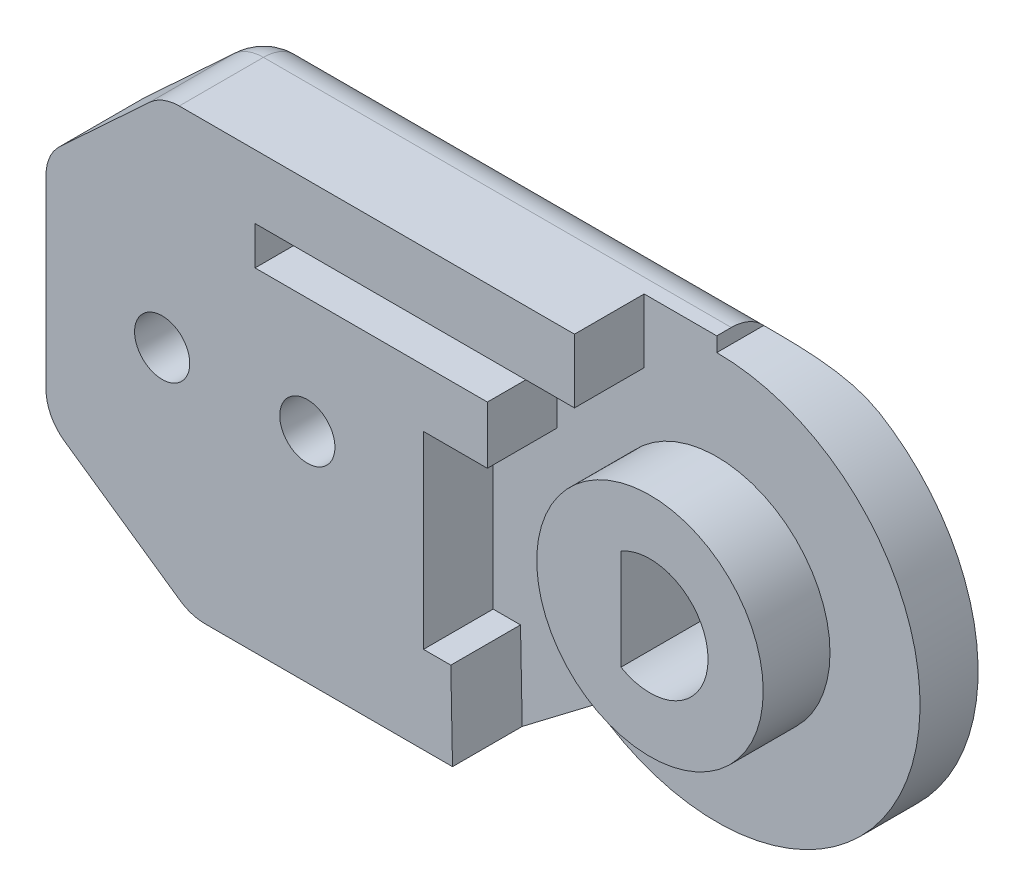
from build123d import *

# Parameters (mm, degrees)
BOSS_EXTRUDE1_DEPTH      = 2
BOSS_EXTRUDE2_DEPTH      = 6
SKETCH24_R               = 3.9
BOSS_EXTRUDE5_DEPTH      = 2.3
SKETCH30_W               = 2.408612022
SKETCH30_H               = 1.324178481
CUT_EXTRUDE12_DEPTH      = 8
CUT_EXTRUDE11_DEPTH      = 23.432788503
FILLET1_R                = 1.5
SKETCH34_R               = 0.75
CUT_EXTRUDE13_DEPTH      = 8
SKETCH35_R               = 0.75
CUT_EXTRUDE14_DEPTH      = 3
CUT_EXTRUDE14_DEPTH_BACK = 8
SKETCH36_R               = 0.95
CUT_EXTRUDE15_DEPTH      = 8
SKETCH37_R               = 2
CUT_EXTRUDE16_DEPTH      = 2.5
SKETCH38_W               = 3
SKETCH38_H               = 1.25
CUT_EXTRUDE17_DEPTH      = 3.6


with BuildPart() as part:
    # Sketch2 → Boss-Extrude1 (new body)
    with BuildSketch(Plane.XY):
        with BuildLine():
            Line((-2.5, 7.5), (-16.7, 7.5))
            Line((-16.7, 7.5), (-20.7, 3.793442666))
            Line((-20.7, 3.793442666), (-20.7, -4.031648778))
            Line((-20.7, -4.031648778), (-15.7, -7.5))
            Line((-15.7, -7.5), (-6.7, -7.5))
            Line((-6.7, -7.5), (-4.2, -5.6))
            ThreePointArc((-4.2, -5.6), (3.130495168, -6.260990337), (7, 0))
            ThreePointArc((7, 0), (4.949747468, 4.949747468), (0, 7))
            Line((0, 7), (0, 7.5))
            Line((0, 7.5), (-2.5, 7.5))
        make_face()
    extrude(amount=BOSS_EXTRUDE1_DEPTH)

    # Sketch4 → Boss-Extrude2 (add)
    with BuildSketch(Plane.XY.offset(2)):
        Polygon((-15.7, -7.5), (-6.7, -7.5), (-6.759079174, -4.5), (-7.7, -4.5), (-7.7, 2), (-5.5, 2), (-5.5, 5.3), (-2.5, 5.3), (-2.5, 7.5), (-16.7, 7.5), (-20.7, 3.793442666), (-20.7, -4.031648778), align=None)
    extrude(amount=BOSS_EXTRUDE2_DEPTH)

    # Sketch24 → Boss-Extrude5 (add)
    with BuildSketch(Plane.XY.offset(2)):
        Circle(SKETCH24_R)
    extrude(amount=BOSS_EXTRUDE5_DEPTH)

    # Sketch30 → Cut-Extrude12 (cut)
    with BuildSketch(Plane(origin=(-5.5, 0, 0), x_dir=(0, 0, -1), z_dir=(1, 0, 0))):
        with Locations((-3.261593395, 4.63791076)):
            Rectangle(SKETCH30_W, SKETCH30_H)
    extrude(amount=-CUT_EXTRUDE12_DEPTH, mode=Mode.SUBTRACT)

    # Sketch28 → Cut-Extrude11 (cut, through all)
    with BuildSketch(Plane.XY.offset(4.3)):
        with BuildLine():
            Line((-1, 1.732050808), (-1, -1.732050808))
            ThreePointArc((-1, -1.732050808), (2, 0), (-1, 1.732050808))
        make_face()
    extrude(amount=-CUT_EXTRUDE11_DEPTH, mode=Mode.SUBTRACT)

    # Fillet1
    fillet1_edges = [part.edges().sort_by_distance(p)[0] for p in [
        (-11.2, -7.5, 0),
        (-8.35, 7.5, 0),
        (-18.7, 5.646721333, 0),
        (-18.2, -5.765824389, 0),
        (-20.7, -0.119103056, 0),
        (-15.7, -7.5, 4),
        (-20.7, -4.031648778, 4),
        (-20.7, 3.793442666, 4),
        (-16.7, 7.5, 4),
    ]]
    fillet(fillet1_edges, radius=FILLET1_R)

    # Sketch34 → Cut-Extrude13 (cut, along a direction that is not the sketch's normal)
    with BuildSketch(Plane.XZ.offset(-2)):
        with Locations((-7, 8)):
            Circle(SKETCH34_R)
    extrude(amount=-CUT_EXTRUDE13_DEPTH, dir=(0.6685833876565112, -0.7436371788377336, 0), mode=Mode.SUBTRACT)

    # Sketch35 → Cut-Extrude14 (cut, two sides, along a direction that is not the sketch's normal)
    with BuildSketch(Plane(origin=(0, -4.5, 0), x_dir=(1, 0, 0), z_dir=(0, 1, 0))) as cut_extrude14_sk:
        with Locations((-8.259079174, -8)):
            Circle(SKETCH35_R)
    extrude(amount=CUT_EXTRUDE14_DEPTH, dir=(0.5999194182208608, 0.8000604299935998, 0), mode=Mode.SUBTRACT)
    extrude(cut_extrude14_sk.sketch, amount=-CUT_EXTRUDE14_DEPTH_BACK, dir=(0.5999194182208608, 0.8000604299935998, 0), mode=Mode.SUBTRACT)

    # Sketch36 → Cut-Extrude15 (cut)
    with BuildSketch(Plane.XY.offset(8)):
        with Locations((-11.7, 0)):
            Circle(SKETCH36_R)
        with Locations((-16.7, 0)):
            Circle(SKETCH36_R)
    extrude(amount=-CUT_EXTRUDE15_DEPTH, mode=Mode.SUBTRACT)

    # Sketch37 → Cut-Extrude16 (cut)
    with BuildSketch(Plane(origin=(0, 0, 0), x_dir=(-1, 0, 0), z_dir=(0, 0, -1))):
        with Locations((11.7, 0)):
            Circle(SKETCH37_R)
        with Locations((16.7, 0)):
            Circle(SKETCH37_R)
    extrude(amount=-CUT_EXTRUDE16_DEPTH, mode=Mode.SUBTRACT)

    # Sketch38 → Cut-Extrude17 (cut)
    with BuildSketch(Plane.XY.offset(8)):
        with Locations((-4, 5.925)):
            Rectangle(SKETCH38_W, SKETCH38_H)
    extrude(amount=-CUT_EXTRUDE17_DEPTH, mode=Mode.SUBTRACT)


with BuildPart() as body_2:
    # Split1: the piece on the far side of the plane
    add(part.part)
    split(bisect_by=Plane.XY.offset(4.4), keep=Keep.BOTTOM)


with BuildPart() as part_1:
    add(part.part)

    # Split1
    split(bisect_by=Plane.XY.offset(4.4), keep=Keep.TOP)


solid = body_2.part
